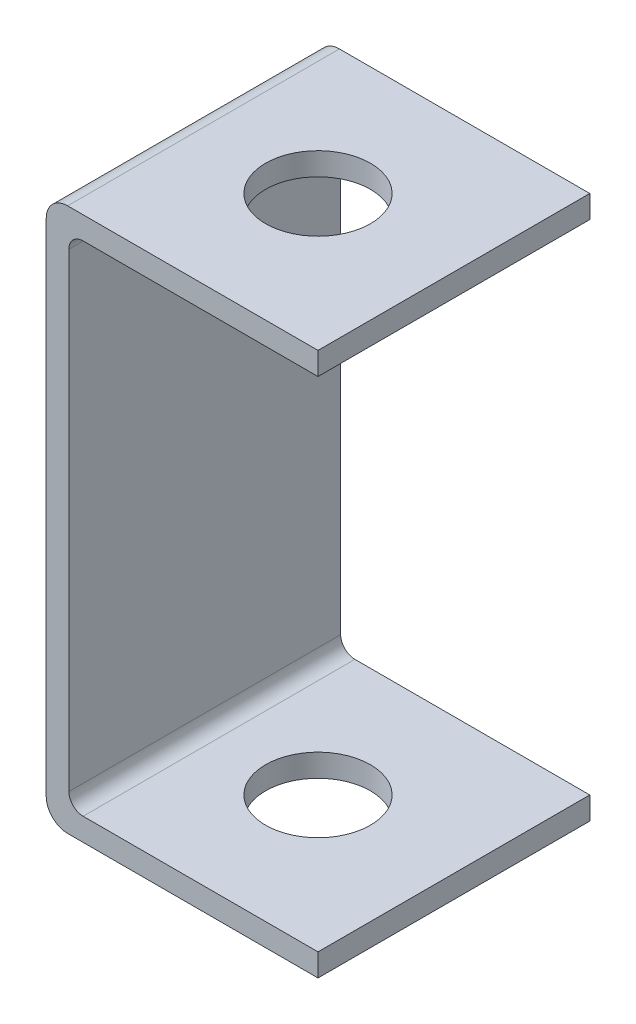
from build123d import *

# Parameters (mm, degrees)
BOSS_EXTRUDE1_DEPTH = 38.1
SKETCH3_R           = 7.35
CUT_EXTRUDE1_DEPTH  = 88.298066989
FILLET1_R           = 2
FILLET2_R           = 3


with BuildPart() as part:
    # Sketch1 → Boss-Extrude1 (new body)
    with BuildSketch(Plane.XY):
        Polygon((-15.875, 73.025), (19.05, 73.025), (19.05, 76.2), (-19.05, 76.2), (-19.05, 0), (19.05, 0), (19.05, 3.175), (-15.875, 3.175), align=None)
    extrude(amount=BOSS_EXTRUDE1_DEPTH)

    # Sketch3 → Cut-Extrude1 (cut, through all)
    with BuildSketch(Plane(origin=(0, 0, 0), x_dir=(1, 0, 0), z_dir=(0, 1, 0))):
        with Locations((0, -19.05)):
            Circle(SKETCH3_R)
    extrude(amount=CUT_EXTRUDE1_DEPTH, mode=Mode.SUBTRACT)

    # Fillet1
    fillet1_edges = [part.edges().sort_by_distance(p)[0] for p in [
        (-15.875, 3.175, 19.05),
        (-15.875, 73.025, 19.05),
    ]]
    fillet(fillet1_edges, radius=FILLET1_R)

    # Fillet2
    fillet2_edges = [part.edges().sort_by_distance(p)[0] for p in [
        (-19.05, 0, 19.05),
        (-19.05, 76.2, 19.05),
    ]]
    fillet(fillet2_edges, radius=FILLET2_R)


solid = part.part
